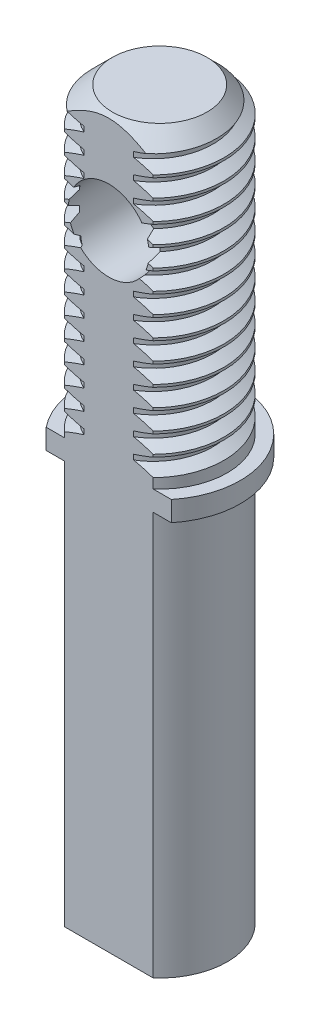
from build123d import *

# Parameters (mm, degrees)
SKETCH_1_R               = 3.35
EXTRUDE_1_DEPTH          = 15
CHAMFER_1_SIZE           = 1
THREAD_1_PITCH           = 1
SKETCH_5_R               = 4
EXTRUDE_2_DEPTH          = 1
EXTRUDE_START            = 20
SKETCH_6_R               = 3.35
EXTRUDE_3_DEPTH          = 20
CUT_EXTRUDE_1_DEPTH      = 22.748563171
CUT_EXTRUDE_1_DEPTH_BACK = 22.748563171
SKETCH_7_R               = 2
SKETCH_8_W               = 7.035809555
SKETCH_8_H               = 1.5
CUT_EXTRUDE_2_DEPTH      = 37.441734415


with BuildPart() as part:
    # Sketch 1 → Бобышка-Вытянуть1 (new body)
    with BuildSketch(Plane(origin=(0, 0, 0), x_dir=(1, 0, 0), z_dir=(0, 1, 0))):
        with Locations(Location((0, 0, 0), (0, 0, 270))):
            Circle(SKETCH_1_R)
    extrude(amount=EXTRUDE_1_DEPTH)

    # Фаска1
    chamfer_1_edges = [part.edges().sort_by_distance(p)[0] for p in [
        (0, 15, -3.35),
    ]]
    chamfer(chamfer_1_edges, length=CHAMFER_1_SIZE)

    # Резьба1: the profile of Sketch 1 2 profile screwed along a right-hand helix of 14 turns, 8 arcs to a turn; built about Z, then put on its axis
    thread_1_z = Axis((0, 0, 0), (0, 0, 1))
    thread_1_corners = [(3.3503, 0, -0.000173205), (3.3503, 0, 0.875173202), (2.808734125, 0, 0.562499999), (2.808734125, 0, 0.312499999)]
    with BuildLine(mode=Mode.PRIVATE) as thread_1_profile:
        Line(thread_1_corners[0], thread_1_corners[1])
        Line(thread_1_corners[1], thread_1_corners[2])
        Line(thread_1_corners[2], thread_1_corners[3])
        Line(thread_1_corners[3], thread_1_corners[0])
    thread_1_cap = Face(thread_1_profile.wire())
    thread_1_turn_angles = [0, 22.5, 45, 67.5, 90, 112.5, 135, 157.5, 180, 202.5, 225, 247.5, 270, 292.5, 315, 337.5, 360]
    thread_1_turn_weights = [1, 0.9238795325112867, 1, 0.9238795325112867, 1, 0.9238795325112867, 1, 0.9238795325112867, 1, 0.9238795325112867, 1, 0.9238795325112867, 1, 0.9238795325112867, 1, 0.9238795325112867, 1]
    thread_1_turn_rails = [Edge.make_bspline([Vector(p[0], p[1], 0).rotate(thread_1_z, thread_1_turn_angles[k]) / thread_1_turn_weights[k] + Vector(0, 0, p[2] + THREAD_1_PITCH * thread_1_turn_angles[k] / 360) for k in range(17)], [0, 0, 0, 1, 1, 2, 2, 3, 3, 4, 4, 5, 5, 6, 6, 7, 7, 8, 8, 8], 2, thread_1_turn_weights) for p in thread_1_corners]
    thread_1_turn_sides = [Face.make_surface_from_curves(thread_1_turn_rails[p[0]], thread_1_turn_rails[p[1]]) for p in [(0, 1), (1, 2), (2, 3), (3, 0)]]
    thread_1 = Plane(origin=(0, 15, 0), x_dir=(-1, 0, 0), z_dir=(0, -1, 0)) * Solid(Shell([*[p.moved(Location((0, 0, THREAD_1_PITCH * i))) for i in range(14) for p in thread_1_turn_sides], thread_1_cap, thread_1_cap.rotate(thread_1_z, 5040).moved(Location((0, 0, THREAD_1_PITCH * 5040 / 360)))]))
    add(thread_1, mode=Mode.SUBTRACT)

    # Эскиз5 → Бобышка-Вытянуть2 (add)
    with BuildSketch(Plane.XZ):
        with Locations(Location((0, 0, 0), (0, 0, 270))):
            Circle(SKETCH_5_R)
    extrude(amount=EXTRUDE_2_DEPTH)

    # Эскиз6 → Бобышка-Вытянуть3 (add)
    with BuildSketch(Plane.XZ.offset(1).offset(EXTRUDE_START)):
        with Locations(Location((0, 0, 0), (0, 0, 225.000001037))):
            Circle(SKETCH_6_R)
    extrude(amount=-EXTRUDE_3_DEPTH)

    # Эскиз7 → Вырез-Вытянуть1 (cut, two sides: drawn at the far end of the back side and taken through both)
    with BuildSketch(Plane.XY.offset(-CUT_EXTRUDE_1_DEPTH_BACK)):
        with Locations(Location((0, 10, 0), (0, 0, 1.762391294))):
            Circle(SKETCH_7_R)
    extrude(amount=CUT_EXTRUDE_1_DEPTH + CUT_EXTRUDE_1_DEPTH_BACK, mode=Mode.SUBTRACT)

    # Эскиз8 → Вырез-Вытянуть2 (cut, through all)
    with BuildSketch(Plane.XZ.offset(21)):
        with Locations((0.143263091, 3.275675225)):
            Rectangle(SKETCH_8_W, SKETCH_8_H)
    extrude(amount=-CUT_EXTRUDE_2_DEPTH, mode=Mode.SUBTRACT)


solid = part.part
